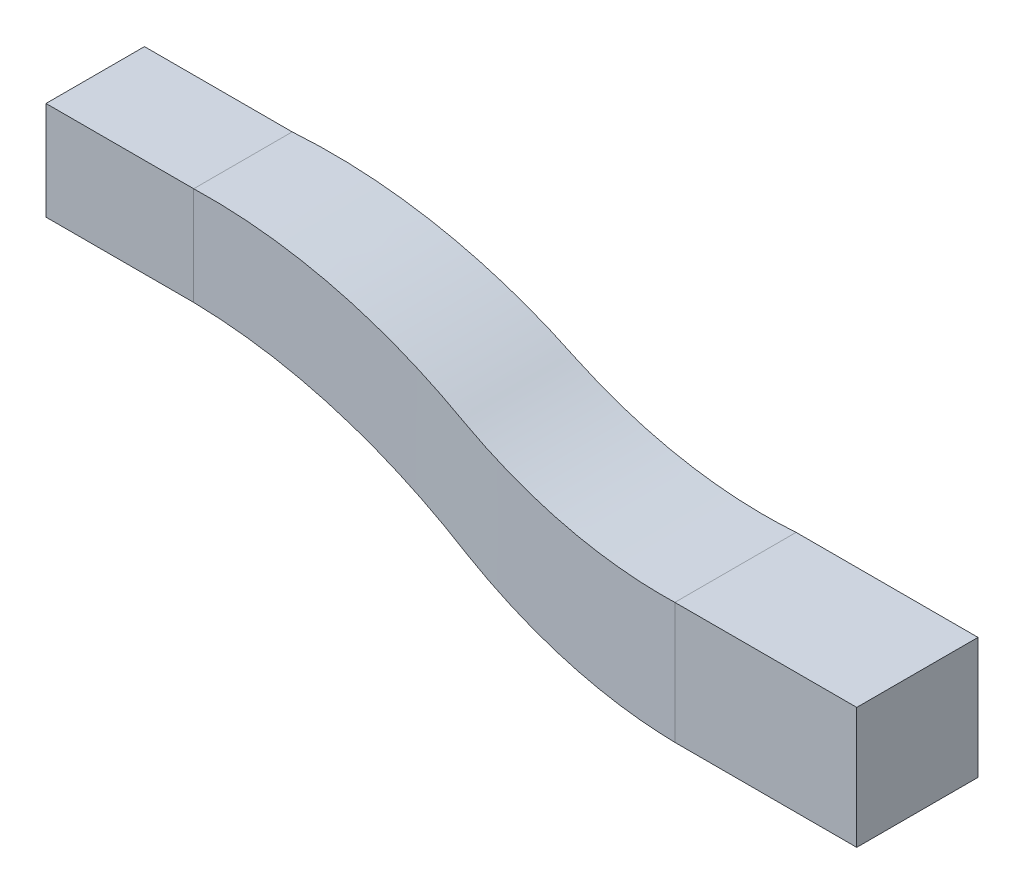
from build123d import *

# Parameters (mm, degrees)
LOFT1_START         = -125.7300001
LOFT1_DEPTH         = 251.4600001
LOFT1_START_2       = -371
LOFT1_2_DEPTH       = 475
SKETCH6_W           = 204.216
SKETCH6_H           = 204.216
BOSS_EXTRUDE1_DEPTH = 306.324
SKETCH8_W           = 251.46
SKETCH8_H           = 251.46
BOSS_EXTRUDE2_DEPTH = 377.19


with BuildPart() as part:
    # Loft1: read off the stored shape, not the designer's step
    # Loft1 outline → Loft1 (new body)
    with BuildSketch(Plane.XY.offset(LOFT1_START)):
        with BuildLine():
            Line((1021.373155762, -369.703305112), (1021.373155762, -118.243305112))
            add(Edge.make_bspline(
                [(0, 102.108), (196.914895518, 111.82689324), (392.936444227, 69.537154328), (708.143629326, -92.279435597), (864.402326567, -125.990726792), (1021.373155762, -118.243305112)],
                knots=[0, 0, 0, 0, 0.556436391, 0.556436391, 1, 1, 1, 1], degree=3))
            Line((0, 102.108), (0, -102.108))
            add(Edge.make_bspline(
                [(0, -102.108), (196.914895518, -101.151867047), (392.936444227, -152.204366245), (708.143629326, -329.768956171), (864.402326567, -370.465487079), (1021.373155762, -369.703305112)],
                knots=[0, 0, 0, 0, 0.556436391, 0.556436391, 1, 1, 1, 1], degree=3))
        make_face()
    extrude(amount=LOFT1_DEPTH)

    # Loft1 2 outline → Loft1 2 (cut)
    with BuildSketch(Plane(origin=(0, 0, 0), x_dir=(1, 0, 0), z_dir=(0, 1, 0)).offset(LOFT1_START_2)):
        with BuildLine():
            Line((0, 125.7300001), (0, 102.108))
            add(Edge.make_bspline(
                [(0, 102.108), (196.914895518, 106.489380143), (392.936444227, 110.870760287), (708.143629326, 118.744760287), (864.402326567, 122.237380143), (1021.373155762, 125.73)],
                knots=[0, 0, 0, 0, 0.556436391, 0.556436391, 1, 1, 1, 1], degree=3))
            Line((1021.373155762, 125.73), (0, 125.7300001))
        make_face()
        with BuildLine():
            add(Edge.make_bspline(
                [(0, -102.108), (196.914895518, -106.489380143), (392.936444227, -110.870760287), (708.143629326, -118.744760287), (864.402326567, -122.237380143), (1021.373155762, -125.73)],
                knots=[0, 0, 0, 0, 0.556436391, 0.556436391, 1, 1, 1, 1], degree=3))
            Line((0, -102.108), (0, -125.73))
            Line((0, -125.73), (1021.373155762, -125.73))
        make_face()
    extrude(amount=LOFT1_2_DEPTH, mode=Mode.SUBTRACT)

    # Sketch6 → Boss-Extrude1 (add)
    with BuildSketch(Plane(origin=(0, 0, 0), x_dir=(0, 0, -1), z_dir=(1, 0, 0))):
        Rectangle(SKETCH6_W, SKETCH6_H)
    extrude(amount=-BOSS_EXTRUDE1_DEPTH)

    # Sketch8 → Boss-Extrude2 (add)
    with BuildSketch(Plane(origin=(1021.373155762, 0, 0), x_dir=(0, 0, -1), z_dir=(1, 0, 0))):
        with Locations((0, -243.973305112)):
            Rectangle(SKETCH8_W, SKETCH8_H)
    extrude(amount=BOSS_EXTRUDE2_DEPTH)


solid = part.part
